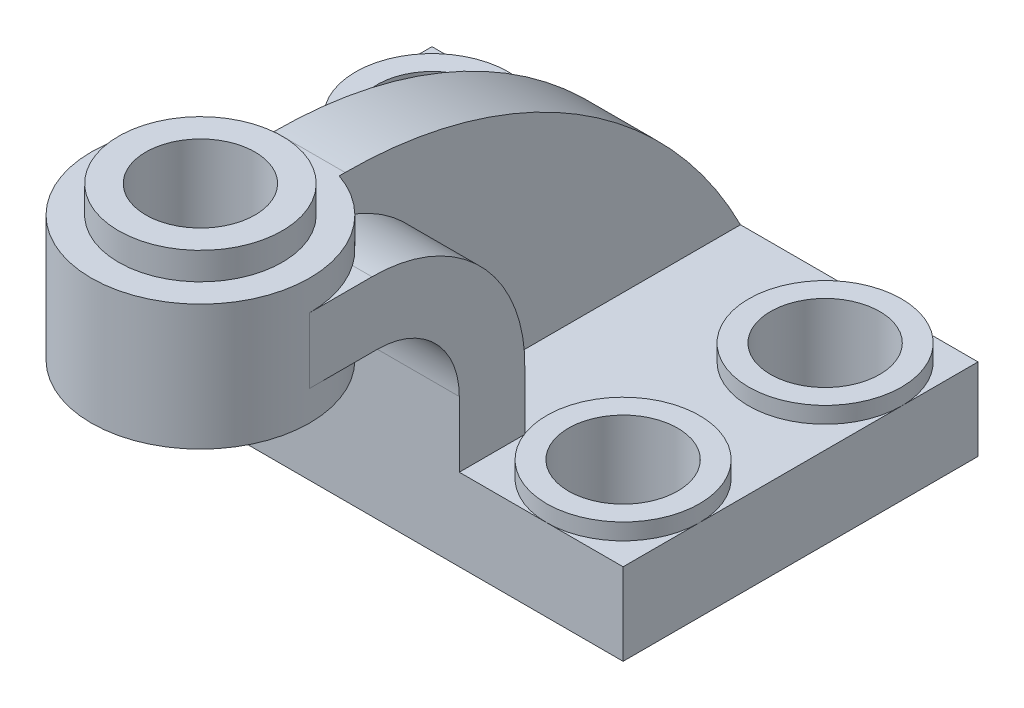
from build123d import *

# Parameters (mm, degrees)
SKETCH1_R             = 14
SKETCH1_R_2           = 10
BOSS_EXTRUDE2_DEPTH   = 3
BOSS_EXTRUDE2_2_DEPTH = 3
BOSS_EXTRUDE2_3_DEPTH = 3
BOSS_EXTRUDE2_4_DEPTH = 3
SKETCH2_W             = 100
SKETCH2_H             = 65
BOSS_EXTRUDE3_DEPTH   = 15
BOSS_EXTRUDE4_DEPTH   = 20
SKETCH4_R             = 20
BOSS_EXTRUDE5_DEPTH   = 5.5
BOSS_EXTRUDE6_START   = -23
SKETCH5_R             = 20
BOSS_EXTRUDE6_DEPTH   = 23
SKETCH6_R             = 15
BOSS_EXTRUDE7_DEPTH   = 5
SKETCH7_R             = 10
CUT_EXTRUDE1_DEPTH    = 120.825265291
BOSS_EXTRUDE8_DEPTH   = 6.5
SKETCH13_R            = 10
CUT_EXTRUDE2_DEPTH    = 113.463746168


with BuildPart() as part:
    # Sketch1 → Boss-Extrude2 (new body)
    with BuildSketch(Plane(origin=(0, 0, 0), x_dir=(1, 0, 0), z_dir=(0, 1, 0))):
        with Locations(Location((50.63816244, 20.825493171, 0), (0, 0, 270))):
            Circle(SKETCH1_R)
        with Locations(Location((50.63816244, 20.825493171, 0), (0, 0, 270))):
            Circle(SKETCH1_R_2, mode=Mode.SUBTRACT)
    extrude(amount=BOSS_EXTRUDE2_DEPTH)



with BuildPart() as body_2:
    # Sketch1 → Boss-Extrude2 2 (new body)
    with BuildSketch(Plane(origin=(0, 0, 0), x_dir=(1, 0, 0), z_dir=(0, 1, 0))):
        with Locations(Location((50.63816244, -16.174506829, 0), (0, 0, 270))):
            Circle(SKETCH1_R)
        with Locations(Location((50.63816244, -16.174506829, 0), (0, 0, 270))):
            Circle(SKETCH1_R_2, mode=Mode.SUBTRACT)
    extrude(amount=BOSS_EXTRUDE2_2_DEPTH)


with BuildPart() as body_3:
    # Sketch1 → Boss-Extrude2 3 (new body)
    with BuildSketch(Plane(origin=(0, 0, 0), x_dir=(1, 0, 0), z_dir=(0, 1, 0))):
        with Locations(Location((-21.36183756, 20.825493171, 0), (0, 0, 270))):
            Circle(SKETCH1_R)
        with Locations(Location((-21.36183756, 20.825493171, 0), (0, 0, 270))):
            Circle(SKETCH1_R_2, mode=Mode.SUBTRACT)
    extrude(amount=BOSS_EXTRUDE2_3_DEPTH)


with BuildPart() as body_4:
    # Sketch1 → Boss-Extrude2 4 (new body)
    with BuildSketch(Plane(origin=(0, 0, 0), x_dir=(1, 0, 0), z_dir=(0, 1, 0))):
        with Locations(Location((-21.36183756, -16.174506829, 0), (0, 0, 270))):
            Circle(SKETCH1_R)
        with Locations(Location((-21.36183756, -16.174506829, 0), (0, 0, 270))):
            Circle(SKETCH1_R_2, mode=Mode.SUBTRACT)
    extrude(amount=BOSS_EXTRUDE2_4_DEPTH)


with BuildPart() as part_1:
    add(part.part)

    add(body_2.part)  # Boss-Extrude3 merges body 2

    add(body_3.part)  # Boss-Extrude3 merges body 3

    add(body_4.part)  # Boss-Extrude3 merges body 4
    # Sketch2 → Boss-Extrude3 (add)
    with BuildSketch(Plane(origin=(0, 0, 0), x_dir=(1, 0, 0), z_dir=(0, 1, 0))):
        with Locations((14.63816244, 2.325493171)):
            Rectangle(SKETCH2_W, SKETCH2_H)
    extrude(amount=-BOSS_EXTRUDE3_DEPTH)

    # Sketch3 → Boss-Extrude4 (add, symmetric)
    with BuildSketch(Plane(origin=(14.63816244, 0, 0), x_dir=(0, 0, -1), z_dir=(1, 0, 0))):
        with BuildLine():
            Line((-30.174506829, 12), (-30.174506829, 0))
            Line((-30.174506829, 0), (-18.174506829, 0))
            Line((-18.174506829, 0), (-18.174506829, 10.52211824))
            ThreePointArc((-18.174506829, 10.52211824), (-26.203196706, 30.629306034), (-46.170428478, 39))
            Line((-46.170428478, 39), (-57.587061699, 39))
            Line((-57.587061699, 39), (-57.587061699, 27))
            Line((-57.587061699, 27), (-45.174506829, 27))
            ThreePointArc((-45.174506829, 27), (-34.567905111, 22.606601718), (-30.174506829, 12))
        make_face()
    extrude(amount=BOSS_EXTRUDE4_DEPTH, both=True)

    # Sketch4 → Boss-Extrude5 (add)
    with BuildSketch(Plane(origin=(0, 39, 0), x_dir=(1, 0, 0), z_dir=(0, 1, 0))):
        with Locations(Location((14.63816244, -57.587061699, 0), (0, 0, 145.191759612))):
            Circle(SKETCH4_R)
    extrude(amount=BOSS_EXTRUDE5_DEPTH)

    # Sketch5 → Boss-Extrude6 (add)
    with BuildSketch(Plane(origin=(0, 44.5, 0), x_dir=(1, 0, 0), z_dir=(0, 1, 0)).offset(BOSS_EXTRUDE6_START)):
        with Locations(Location((14.63816244, -57.587061699, 0), (0, 0, 270))):
            Circle(SKETCH5_R)
    extrude(amount=BOSS_EXTRUDE6_DEPTH)

    # Sketch6 → Boss-Extrude7 (add)
    with BuildSketch(Plane(origin=(0, 44.5, 0), x_dir=(1, 0, 0), z_dir=(0, 1, 0))):
        with Locations(Location((14.63816244, -57.587061699, 0), (0, 0, 270))):
            Circle(SKETCH6_R)
    extrude(amount=BOSS_EXTRUDE7_DEPTH)

    # Sketch7 → Cut-Extrude1 (cut, through all)
    with BuildSketch(Plane(origin=(0, 49.5, 0), x_dir=(1, 0, 0), z_dir=(0, 1, 0))):
        with Locations(Location((14.63816244, -57.587061699, 0), (0, 0, 270))):
            Circle(SKETCH7_R)
    extrude(amount=-CUT_EXTRUDE1_DEPTH, mode=Mode.SUBTRACT)


with BuildPart() as boss_extrude8_tool:
    # Sketch12 → Boss-Extrude8 (new, symmetric)
    with BuildSketch(Plane(origin=(14.63816244, 0, 0), x_dir=(0, 0, -1), z_dir=(1, 0, 0))):
        with BuildLine():
            Line((-18.170428478, 11), (-18.174506829, 3))
            Line((-18.174506829, 3), (-18.174506829, 0))
            Line((-18.174506829, 0), (31.654695104, 0))
            Line((31.654695104, 0), (34.825493171, 0))
            ThreePointArc((34.825493171, 0), (4.909491405, 32.485841169), (-37.587061699, 44.5))
            Line((-37.587061699, 44.5), (-42.002826433, 44.5))
            Line((-42.002826433, 44.5), (-42.002826433, 38.688103821))
            ThreePointArc((-42.002826433, 38.688103821), (-39.774060831, 38.259017893), (-37.587061699, 37.651938292))
            ThreePointArc((-37.587061699, 37.651938292), (-23.535561338, 27.490091956), (-18.170428478, 11))
        make_face()
    extrude(amount=BOSS_EXTRUDE8_DEPTH, both=True)


with BuildPart() as part_2:
    add(part_1.part)


with BuildPart() as part_3:
    # Boss-Extrude8: joined with boss_extrude8_tool
    add(part_2.part.fuse(boss_extrude8_tool.part, tol=0.00001))

    # Sketch13 → Cut-Extrude2 (cut, through all)
    with BuildSketch(Plane(origin=(0, 0, 0), x_dir=(1, 0, 0), z_dir=(0, 1, 0))):
        with Locations(Location((-21.36183756, 20.825493171, 0), (0, 0, 270))):
            Circle(SKETCH13_R)
        with Locations(Location((-21.36183756, -16.174506829, 0), (0, 0, 270))):
            Circle(SKETCH13_R)
        with Locations(Location((50.63816244, 20.825493171, 0), (0, 0, 270))):
            Circle(SKETCH13_R)
        with Locations(Location((50.63816244, -16.174506829, 0), (0, 0, 270))):
            Circle(SKETCH13_R)
    extrude(amount=-CUT_EXTRUDE2_DEPTH, mode=Mode.SUBTRACT)


solid = part_3.part
